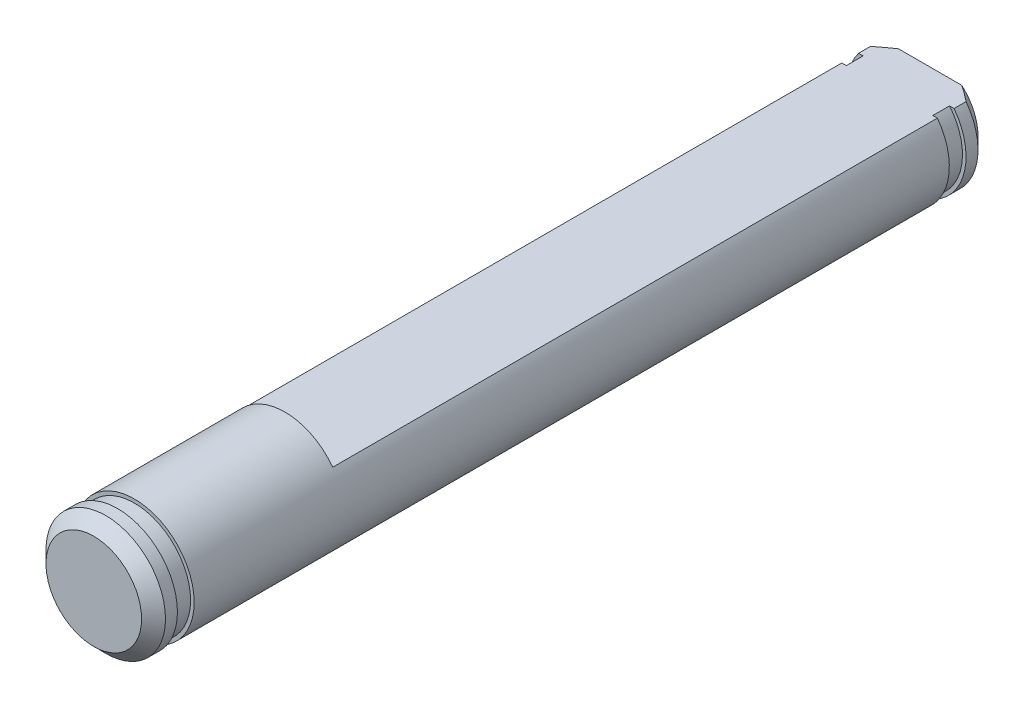
from build123d import *

# Parameters (mm, degrees)
SZKIC1_R                    = 2.5
DODANIE_WYCI_GNI_CIE1_DEPTH = 35
SFAZOWANIE1_SIZE            = 0.5
WYTNIJ_WYCI_GNI_CIE1_START  = -1.7
SZKIC2_R                    = 2.5
SZKIC2_R_2                  = 2.35
WYTNIJ_WYCI_GNI_CIE1_DEPTH  = 0.7
WYTNIJ_WYCI_GNI_CIE2_START  = -1
SZKIC3_R                    = 2.5
SZKIC3_R_2                  = 2.35
WYTNIJ_WYCI_GNI_CIE2_DEPTH  = 0.7
WYTNIJ_WYCI_GNI_CIE3_START  = -35
WYTNIJ_WYCI_GNI_CIE3_DEPTH  = 27


with BuildPart() as part:
    # Szkic1 → Dodanie-wyciągnięcie1 (new body)
    with BuildSketch(Plane.XY):
        Circle(SZKIC1_R)
    extrude(amount=DODANIE_WYCI_GNI_CIE1_DEPTH)

    # Sfazowanie1
    sfazowanie1_edges = [part.edges().sort_by_distance(p)[0] for p in [
        (-2.5, 0, 0),
        (-2.5, 0, 35),
    ]]
    chamfer(sfazowanie1_edges, length=SFAZOWANIE1_SIZE)

    # Szkic2 → Wytnij-wyciągnięcie1 (cut)
    with BuildSketch(Plane.XY.offset(35).offset(WYTNIJ_WYCI_GNI_CIE1_START)):
        Circle(SZKIC2_R)
        Circle(SZKIC2_R_2, mode=Mode.SUBTRACT)
    extrude(amount=WYTNIJ_WYCI_GNI_CIE1_DEPTH, mode=Mode.SUBTRACT)

    # Szkic3 → Wytnij-wyciągnięcie2 (cut)
    with BuildSketch(Plane(origin=(0, 0, 0), x_dir=(-1, 0, 0), z_dir=(0, 0, -1)).offset(WYTNIJ_WYCI_GNI_CIE2_START)):
        Circle(SZKIC3_R)
        Circle(SZKIC3_R_2, mode=Mode.SUBTRACT)
    extrude(amount=-WYTNIJ_WYCI_GNI_CIE2_DEPTH, mode=Mode.SUBTRACT)

    # Szkic4 → Wytnij-wyciągnięcie3 (cut)
    with BuildSketch(Plane.XY.offset(35).offset(WYTNIJ_WYCI_GNI_CIE3_START)):
        with BuildLine():
            Line((-2, 1.5), (2, 1.5))
            ThreePointArc((2, 1.5), (0, 2.5), (-2, 1.5))
        make_face()
    extrude(amount=WYTNIJ_WYCI_GNI_CIE3_DEPTH, mode=Mode.SUBTRACT)


solid = part.part
